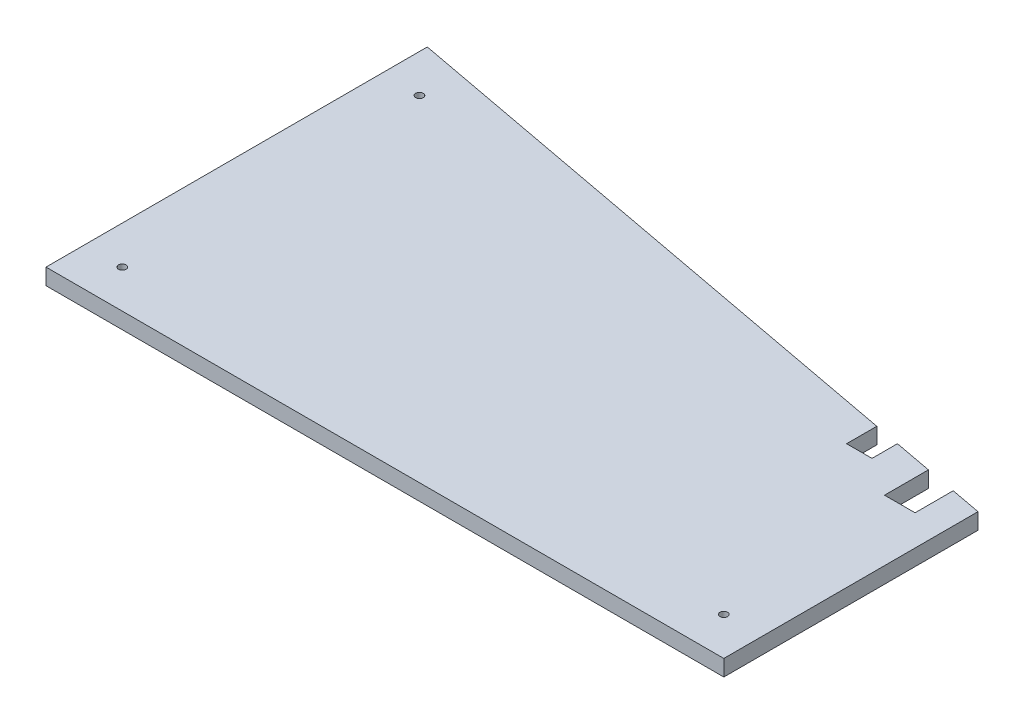
from build123d import *

# Parameters (mm, degrees)
BOSS_EXTRUDE1_DEPTH = 6.35
SKETCH3_R           = 1.5
CUT_EXTRUDE1_DEPTH  = 307.010694258


with BuildPart() as part:
    # Sketch2 → Boss-Extrude1 (new body)
    with BuildSketch(Plane(origin=(0, 0, 0), x_dir=(1, 0, 0), z_dir=(0, 1, 0))):
        Polygon((0, 0), (266.65, 0), (266.65, 100), (254.65, 102.250140634), (254.65, 87.250140634), (242.650050871, 87.215199066), (242.650050871, 104.500271729), (227.650050871, 107.312947521), (227.650050871, 97.312947521), (217.650050871, 97.283829424), (217.650050871, 109.188064716), (0, 150), align=None)
    extrude(amount=BOSS_EXTRUDE1_DEPTH)

    # Sketch3 → Cut-Extrude1 (cut, through all)
    with BuildSketch(Plane(origin=(0, 6.35, 0), x_dir=(1, 0, 0), z_dir=(0, 1, 0))):
        with Locations((15, 131.925897501)):
            Circle(SKETCH3_R)
        with Locations((15, 15)):
            Circle(SKETCH3_R)
        with Locations((251.65, 15)):
            Circle(SKETCH3_R)
    extrude(amount=-CUT_EXTRUDE1_DEPTH, mode=Mode.SUBTRACT)


solid = part.part
